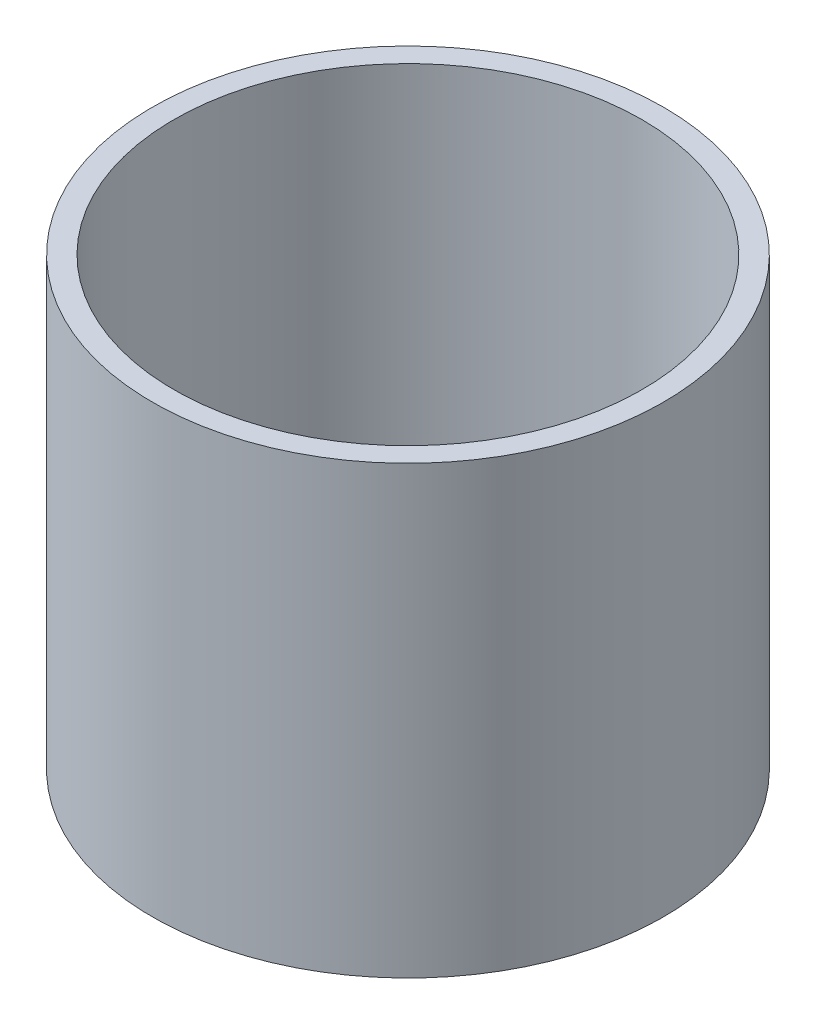
from build123d import *

# Parameters (mm, degrees)
SKETCH1_R           = 43.68
SKETCH1_R_2         = 40
BOSS_EXTRUDE1_DEPTH = 76.2


with BuildPart() as part:
    # Sketch1 → Boss-Extrude1 (new body)
    with BuildSketch(Plane(origin=(0, 0, 0), x_dir=(1, 0, 0), z_dir=(0, 1, 0))):
        Circle(SKETCH1_R)
        Circle(SKETCH1_R_2, mode=Mode.SUBTRACT)
    extrude(amount=BOSS_EXTRUDE1_DEPTH)


solid = part.part
